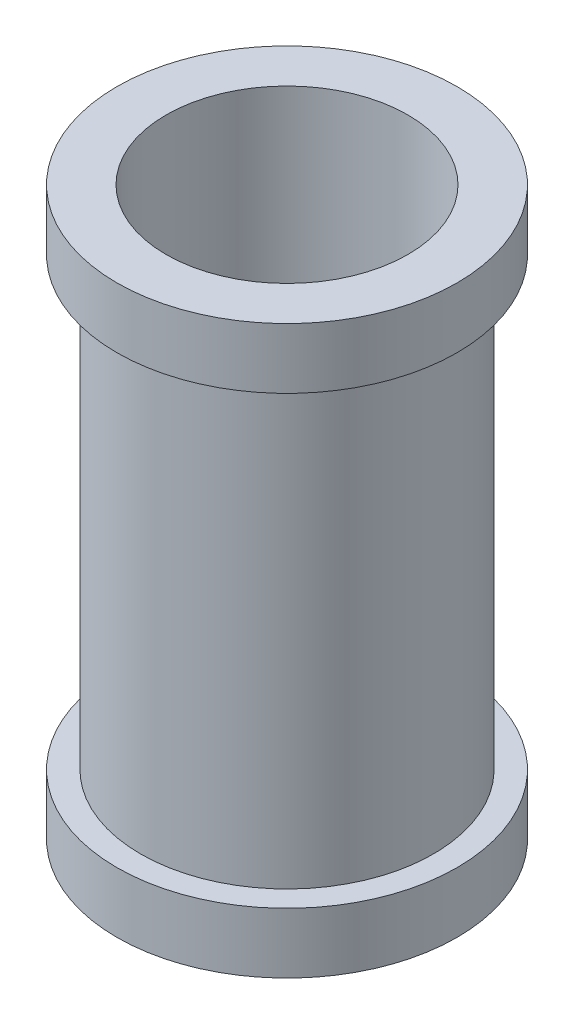
from build123d import *


with BuildPart() as part:
    # Sketch3 → Revolve1 (revolve)
    with BuildSketch(Plane.XY):
        Polygon((0, 0), (8.255, 0), (8.255, 10.16), (4.28625, 10.16), (4.28625, 85.09), (8.255, 85.09), (8.255, 95.25), (0, 95.25), align=None)
    revolve(axis=Axis((-20.32, 95.25, 0), (0, -1, 0)))


solid = part.part
